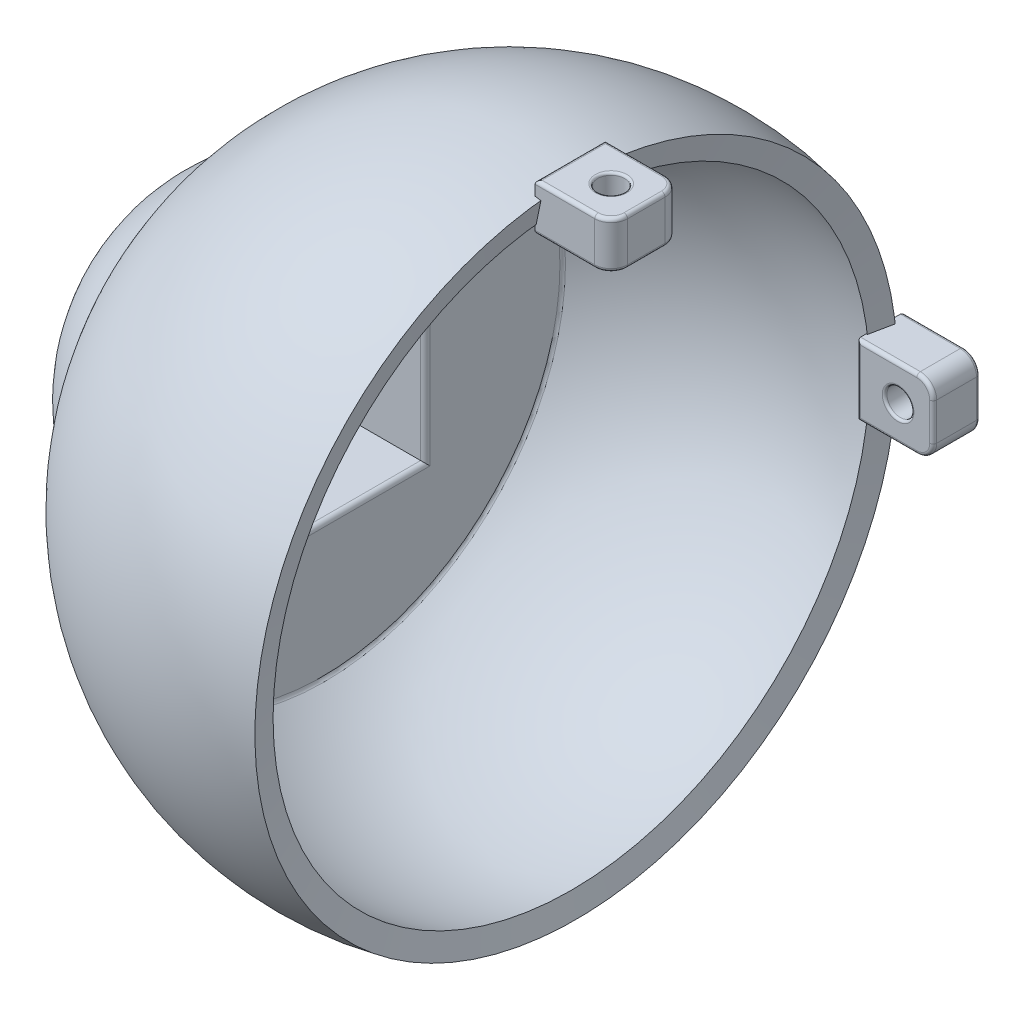
from build123d import *

# Parameters (mm, degrees)
SHELL3_T                        = -1
SKETCH3_R                       = 4.25
CUT_EXTRUDE2_DEPTH              = 71
EXTRUDE_THIN1_REACH             = 26.74
EXTRUDE_THIN1_END_RADIUS        = 7.082903769
SKETCH6_W                       = 9.8
SKETCH6_H                       = 9.911877538
SKETCH6_W_2                     = 8.8
SKETCH6_H_2                     = 8.911877538
EXTRUDE_THIN1_DIRECTION_2_DEPTH = 4
BOSS_EXTRUDE5_REACH             = 26.38
BOSS_EXTRUDE5_END_RADIUS        = 7.082903769
SKETCH8_W                       = 8.8
SKETCH8_H                       = 8.911877538
SKETCH8_R                       = 4.25
BOSS_EXTRUDE7_REACH             = 29.912
BOSS_EXTRUDE7_END_RADIUS        = 13
BOSS_EXTRUDE8_REACH             = 29.912
BOSS_EXTRUDE8_END_RADIUS        = 13
BOSS_EXTRUDE9_REACH             = 29.874
BOSS_EXTRUDE9_END_RADIUS        = 13
BOSS_EXTRUDE10_REACH            = 29.874
BOSS_EXTRUDE10_END_RADIUS       = 13
BOSS_EXTRUDE11_START            = 0.25
BOSS_EXTRUDE11_DEPTH            = 2
SKETCH17_R                      = 0.575
CUT_EXTRUDE3_DEPTH              = 2
FILLET1_R                       = 0.7
FILLET2_R                       = 0.15
FILLET9_R                       = 0.1
CIRPATTERN4_COUNT               = 2
CIRPATTERN4_ANGLE               = 90
FILLET6_R                       = 0.2
FILLET7_R                       = 0.2
FILLET8_R                       = 0.4


with BuildPart() as part:
    # Sketch2 → Revolve1 (revolve)
    with BuildSketch(Plane.XY):
        with BuildLine():
            Line((0, 0), (2.834192463, 13.710118639))
            ThreePointArc((2.834192463, 13.710118639), (-5.730026707, 12.773675819), (-12.124355653, 7))
            ThreePointArc((-12.124355653, 7), (-15.082903769, 4.041451884), (-16.165807537, 0))
            Line((-16.165807537, 0), (0, 0))
        make_face()
    revolve(axis=Axis((0, 0, 0), (-1, 0, 0)))

    # Shell3
    shell3_openings = [part.faces().sort_by_distance(p)[0] for p in [
        (1.417096231, -6.855059319, 0),
    ]]
    offset(amount=SHELL3_T, openings=shell3_openings, kind=Kind.INTERSECTION)

    # Sketch3 → Cut-Extrude2 (cut)
    with BuildSketch(Plane(origin=(0, 0, 0), x_dir=(0, 0, -1), z_dir=(1, 0, 0))):
        Circle(SKETCH3_R)
    extrude(amount=-CUT_EXTRUDE2_DEPTH, mode=Mode.SUBTRACT)

    # Extrude-Thin1: up to this sphere (the profile starts inside it)
    extrude_thin1_end = Location((-8.082903769, 0, 0)) * Sphere(EXTRUDE_THIN1_END_RADIUS, mode=Mode.PRIVATE)
    # Sketch6 → Extrude-Thin1 (add, up to the surface)
    with BuildSketch(Plane(origin=(-12, 0, 0), x_dir=(0, 0, -1), z_dir=(1, 0, 0)), mode=Mode.PRIVATE) as extrude_thin1_sk1:
        Rectangle(SKETCH6_W, SKETCH6_H)
        Rectangle(SKETCH6_W_2, SKETCH6_H_2, mode=Mode.SUBTRACT)
    extrude_thin1_tool1 = extrude(extrude_thin1_sk1.sketch, amount=-EXTRUDE_THIN1_REACH, mode=Mode.PRIVATE) & extrude_thin1_end
    add(extrude_thin1_tool1.solids().sort_by_distance((-12, -4.816553, 0))[0])
    add(extrude_thin1_tool1.solids().sort_by_distance((-12, -4.816553, 0))[1])
    add(extrude_thin1_tool1.solids().sort_by_distance((-12, -4.816553, 0))[2])
    add(extrude_thin1_tool1.solids().sort_by_distance((-12, -4.816553, 0))[3])

    # Sketch6 → Extrude-Thin1 direction 2 (add)
    with BuildSketch(Plane(origin=(-12, 0, 0), x_dir=(0, 0, -1), z_dir=(1, 0, 0))):
        Rectangle(SKETCH6_W, SKETCH6_H)
        Rectangle(SKETCH6_W_2, SKETCH6_H_2, mode=Mode.SUBTRACT)
    extrude(amount=EXTRUDE_THIN1_DIRECTION_2_DEPTH)

    # Boss-Extrude5: up to this sphere (the profile starts inside it)
    boss_extrude5_end = Location((-8.082903769, 0, 0)) * Sphere(BOSS_EXTRUDE5_END_RADIUS, mode=Mode.PRIVATE)
    # Sketch8 → Boss-Extrude5 (add, up to the surface)
    with BuildSketch(Plane(origin=(-11.392304845, 0, 0), x_dir=(0, 0, -1), z_dir=(1, 0, 0)), mode=Mode.PRIVATE) as boss_extrude5_sk1:
        Rectangle(SKETCH8_W, SKETCH8_H)
        Circle(SKETCH8_R, mode=Mode.SUBTRACT)
    boss_extrude5_tool1 = extrude(boss_extrude5_sk1.sketch, amount=-BOSS_EXTRUDE5_REACH, mode=Mode.PRIVATE) & boss_extrude5_end
    add(boss_extrude5_tool1.solids().sort_by_distance((-11.392305, 4.330694, 0))[0])

    # Boss-Extrude7: up to this sphere (the profile starts inside it)
    boss_extrude7_end = Location((0, 0, 0)) * Sphere(BOSS_EXTRUDE7_END_RADIUS, mode=Mode.PRIVATE)
    # Sketch12 → Boss-Extrude7 (add, up to the surface)
    with BuildSketch(Plane(origin=(0, 4.955938769, 0), x_dir=(1, 0, 0), z_dir=(0, 1, 0)), mode=Mode.PRIVATE) as boss_extrude7_sk1:
        with BuildLine():
            Line((-10.973999769, -4.9), (-8, -4.9))
            Line((-8, -4.9), (-8, 4.9))
            Line((-8, 4.9), (-10.973999769, 4.9))
            ThreePointArc((-10.973999769, 4.9), (-11.195988483, 4.369040262), (-11.392304845, 3.828062334))
            ThreePointArc((-11.392304845, 3.828062334), (-13.143160355, 0), (-11.392304845, -3.828062334))
            ThreePointArc((-11.392304845, -3.828062334), (-11.195988483, -4.369040262), (-10.973999769, -4.9))
        make_face()
    boss_extrude7_tool1 = extrude(boss_extrude7_sk1.sketch, amount=BOSS_EXTRUDE7_REACH, mode=Mode.PRIVATE) & boss_extrude7_end
    add(boss_extrude7_tool1.solids().sort_by_distance((-10.21205, 4.955939, 0))[0])

    # Boss-Extrude8: up to this sphere (the profile starts inside it)
    boss_extrude8_end = Location((0, 0, 0)) * Sphere(BOSS_EXTRUDE8_END_RADIUS, mode=Mode.PRIVATE)
    # Sketch13 → Boss-Extrude8 (add, up to the surface)
    with BuildSketch(Plane.XZ.offset(4.955938769), mode=Mode.PRIVATE) as boss_extrude8_sk1:
        with BuildLine():
            Line((-10.973999769, -4.9), (-8, -4.9))
            Line((-8, -4.9), (-8, 4.9))
            Line((-8, 4.9), (-10.973999769, 4.9))
            ThreePointArc((-10.973999769, 4.9), (-11.195988483, 4.369040262), (-11.392304845, 3.828062334))
            ThreePointArc((-11.392304845, 3.828062334), (-13.143160355, 0), (-11.392304845, -3.828062334))
            ThreePointArc((-11.392304845, -3.828062334), (-11.195988483, -4.369040262), (-10.973999769, -4.9))
        make_face()
    boss_extrude8_tool1 = extrude(boss_extrude8_sk1.sketch, amount=BOSS_EXTRUDE8_REACH, mode=Mode.PRIVATE) & boss_extrude8_end
    add(boss_extrude8_tool1.solids().sort_by_distance((-10.21205, -4.955939, 0))[0])

    # Boss-Extrude9: up to this sphere (the profile starts inside it)
    boss_extrude9_end = Location((0, 0, 0)) * Sphere(BOSS_EXTRUDE9_END_RADIUS, mode=Mode.PRIVATE)
    # Sketch14 → Boss-Extrude9 (add, up to the surface)
    with BuildSketch(Plane.XY.offset(4.9), mode=Mode.PRIVATE) as boss_extrude9_sk1:
        with BuildLine():
            Line((-8, -8.999444427), (-8, 8.999444427))
            ThreePointArc((-8, 8.999444427), (-10.025864662, 6.668735846), (-11.392304845, 3.899408969))
            ThreePointArc((-11.392304845, 3.899408969), (-13.197346631, 0), (-11.392304845, -3.899408969))
            ThreePointArc((-11.392304845, -3.899408969), (-10.025864662, -6.668735846), (-8, -8.999444427))
        make_face()
    boss_extrude9_tool1 = extrude(boss_extrude9_sk1.sketch, amount=BOSS_EXTRUDE9_REACH, mode=Mode.PRIVATE) & boss_extrude9_end
    add(boss_extrude9_tool1.solids().sort_by_distance((-9.949858, 0, 4.9))[0])

    # Boss-Extrude10: up to this sphere (the profile starts inside it)
    boss_extrude10_end = Location((0, 0, 0)) * Sphere(BOSS_EXTRUDE10_END_RADIUS, mode=Mode.PRIVATE)
    # Sketch15 → Boss-Extrude10 (add, up to the surface)
    with BuildSketch(Plane(origin=(0, 0, -4.9), x_dir=(-1, 0, 0), z_dir=(0, 0, -1)), mode=Mode.PRIVATE) as boss_extrude10_sk1:
        with BuildLine():
            Line((8, 8.999444427), (8, -8.999444427))
            ThreePointArc((8, -8.999444427), (10.025864662, -6.668735846), (11.392304845, -3.899408969))
            ThreePointArc((11.392304845, -3.899408969), (13.197346631, 0), (11.392304845, 3.899408969))
            ThreePointArc((11.392304845, 3.899408969), (10.025864662, 6.668735846), (8, 8.999444427))
        make_face()
    boss_extrude10_tool1 = extrude(boss_extrude10_sk1.sketch, amount=BOSS_EXTRUDE10_REACH, mode=Mode.PRIVATE) & boss_extrude10_end
    add(boss_extrude10_tool1.solids().sort_by_distance((-9.949858, 0, -4.9))[0])

    # Fillet6
    fillet6_edges = [part.edges().sort_by_distance(p)[0] for p in [
        (-8, 0, 4.4),
        (-8, -4.455938769, 0),
        (-8, 0, -4.4),
        (-8, 4.455938769, 0),
        (-8, -10.246950766, 0),
    ]]
    fillet(fillet6_edges, radius=FILLET6_R)

    # Fillet7
    fillet7_edges = [part.edges().sort_by_distance(p)[0] for p in [
        (-14.958282546, 3.00520382, -3.00520382),
        (-11.392304845, 0, 4.25),
    ]]
    fillet(fillet7_edges, radius=FILLET7_R)

    # Fillet8
    fillet8_edges = [part.edges().sort_by_distance(p)[0] for p in [
        (-12.124355653, -7, 0),
    ]]
    fillet(fillet8_edges, radius=FILLET8_R)


with BuildPart() as body_2:
    # Sketch16 → Boss-Extrude11 (new body)
    with BuildSketch(Plane(origin=(0, 0, -14), x_dir=(-1, 0, 0), z_dir=(0, 0, -1)).offset(BOSS_EXTRUDE11_START)):
        Polygon((-5.834192463, 1.5), (-2.834192463, 1.5), (-2.584192463, 1.5), (-2.584192463, -1.5), (-2.834192463, -1.5), (-5.834192463, -1.5), align=None)
    extrude(amount=-BOSS_EXTRUDE11_DEPTH)

    # Sketch17 → Cut-Extrude3 (cut)
    with BuildSketch(Plane(origin=(0, 13.25, -14.25), x_dir=(1, 0, 0), z_dir=(0, 0, 1))):
        with Locations((4.334192463, -13.25)):
            Circle(SKETCH17_R)
    extrude(amount=CUT_EXTRUDE3_DEPTH, mode=Mode.SUBTRACT)

    # Fillet1
    fillet1_edges = [body_2.edges().sort_by_distance(p)[0] for p in [
        (5.834192463, -1.5, -13.25),
        (5.834192463, 1.5, -13.25),
    ]]
    fillet(fillet1_edges, radius=FILLET1_R)

    # Fillet2
    fillet2_edges = [body_2.edges().sort_by_distance(p)[0] for p in [
        (3.859192463, 1.5, -14.25),
        (3.859192463, 1.5, -12.25),
        (3.859192463, -1.5, -12.25),
        (3.859192463, -1.5, -14.25),
        (2.584192463, 0, -12.25),
        (2.584192463, 0, -14.25),
        (5.62916721, -1.294974747, -14.25),
        (5.834192463, 0, -14.25),
        (5.62916721, 1.294974747, -14.25),
        (5.62916721, -1.294974747, -12.25),
        (5.834192463, 0, -12.25),
        (5.62916721, 1.294974747, -12.25),
    ]]
    fillet(fillet2_edges, radius=FILLET2_R)

    # Fillet9
    fillet9_edges = [body_2.edges().sort_by_distance(p)[0] for p in [
        (3.759192463, 0, -12.25),
        (3.759192463, 0, -14.25),
    ]]
    fillet(fillet9_edges, radius=FILLET9_R)


with BuildPart() as cirpattern4_1:
    # CirPattern4: pattern copy
    add(body_2.part.rotate(Axis((-17.248382677, 0, 0), (1, 0, 0)), 1 * CIRPATTERN4_ANGLE / (CIRPATTERN4_COUNT - 1)))


solid = Compound([part.part, body_2.part, cirpattern4_1.part])
